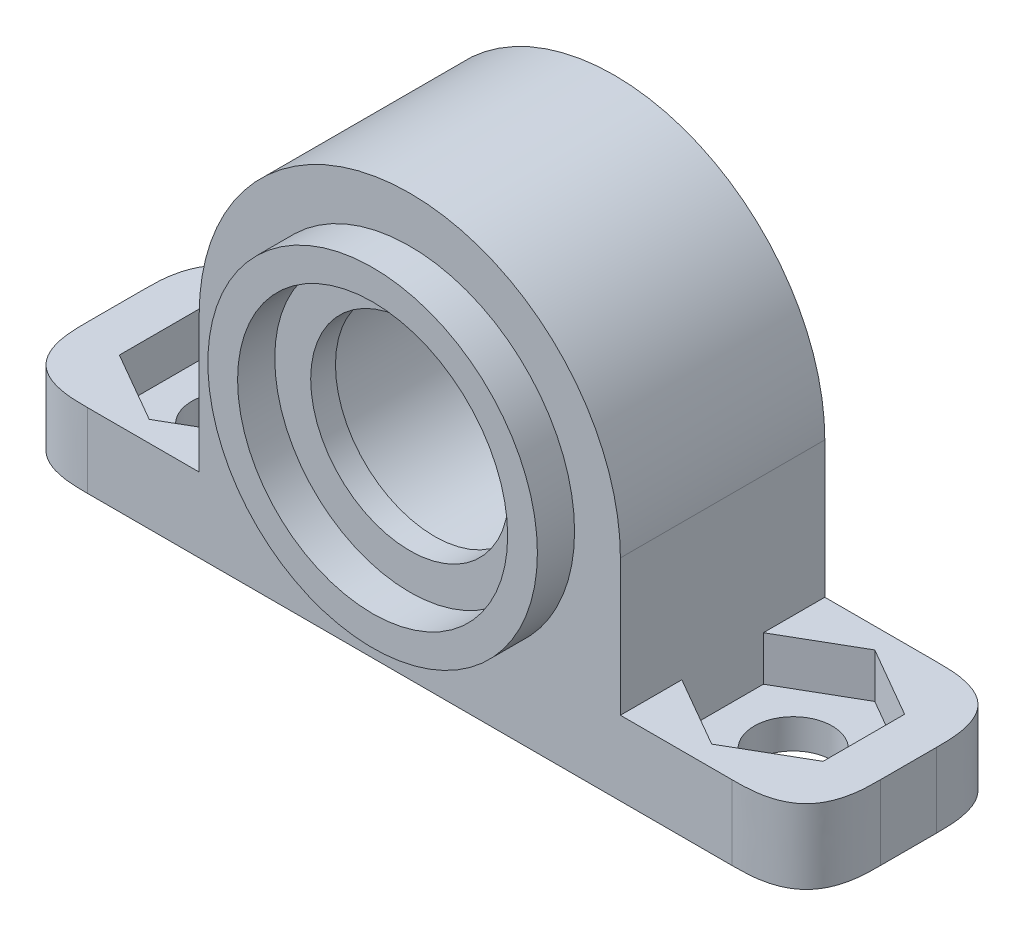
from build123d import *

# Parameters (mm, degrees)
SKETCH1_R           = 8.5
SKETCH1_R_2         = 4.6
BOSS_EXTRUDE1_DEPTH = 5.75
BOSS_EXTRUDE2_START = 1.5
SKETCH2_R           = 8.5
SKETCH2_R_2         = 7.1
BOSS_EXTRUDE2_DEPTH = 1.5
SKETCH3_R           = 8.5
SKETCH3_R_2         = 4
BOSS_EXTRUDE3_DEPTH = 1
SKETCH4_R           = 6.65
SKETCH4_R_2         = 5.45
BOSS_EXTRUDE4_DEPTH = 1.5
BOSS_EXTRUDE5_START = -8.25
SKETCH5_R           = 7.1
BOSS_EXTRUDE5_DEPTH = 8.25
FILLET1_SIZE        = 3
SKETCH6_R           = 1.575
CUT_EXTRUDE1_DEPTH  = 1.8
SKETCH6_3_R         = 1.575
CUT_EXTRUDE2_DEPTH  = 23.804878934
SHELL1_START        = 2
SHELL1_DEPTH        = 2.75
SHELL1_START_2      = 0.5
SHELL1_2_DEPTH      = 1.5


with BuildPart() as part:
    # Sketch1 → Boss-Extrude1 (new body)
    with BuildSketch(Plane.XY):
        Circle(SKETCH1_R)
        Circle(SKETCH1_R_2, mode=Mode.SUBTRACT)
    extrude(amount=BOSS_EXTRUDE1_DEPTH)

    # Sketch2 → Boss-Extrude2 (add)
    with BuildSketch(Plane(origin=(0, 0, 0), x_dir=(-1, 0, 0), z_dir=(0, 0, -1)).offset(BOSS_EXTRUDE2_START)):
        Circle(SKETCH2_R)
        Circle(SKETCH2_R_2, mode=Mode.SUBTRACT)
    extrude(amount=-BOSS_EXTRUDE2_DEPTH)

    # Sketch3 → Boss-Extrude3 (add)
    with BuildSketch(Plane.XY.offset(5.75)):
        with Locations(Location((0, 0, 0), (0, 0, 180))):
            Circle(SKETCH3_R)
        Circle(SKETCH3_R_2, mode=Mode.SUBTRACT)
    extrude(amount=BOSS_EXTRUDE3_DEPTH)

    # Sketch4 → Boss-Extrude4 (add)
    with BuildSketch(Plane.XY.offset(6.75)):
        Circle(SKETCH4_R)
        Circle(SKETCH4_R_2, mode=Mode.SUBTRACT)
    extrude(amount=BOSS_EXTRUDE4_DEPTH)

    # Sketch5 → Boss-Extrude5 (add)
    with BuildSketch(Plane.XY.offset(6.75).offset(BOSS_EXTRUDE5_START)):
        with BuildLine():
            Line((-8.5, 0), (-8.5, -5.5))
            Line((-8.5, -5.5), (-16, -5.5))
            Line((-16, -5.5), (-16, -8.5))
            Line((-16, -8.5), (16, -8.5))
            Line((16, -8.5), (16, -5.5))
            Line((16, -5.5), (8.5, -5.5))
            Line((8.5, -5.5), (8.5, 0))
            ThreePointArc((8.5, 0), (0, 8.5), (-8.5, 0))
        make_face()
        with Locations(Location((0, 0, 0), (0, 0, 180))):
            Circle(SKETCH5_R, mode=Mode.SUBTRACT)
    extrude(amount=BOSS_EXTRUDE5_DEPTH)

    # Fillet1
    # a fillet whose section is not a circle: 3 mm, written as the material it takes off along each edge
    with BuildSketch(Plane(origin=(-16, 2, -1.5), x_dir=(0, 0, 1), z_dir=(0, -1, 0)), Plane(origin=(-16, 2, 6.75), x_dir=(1, 0, 0), z_dir=(0, -1, 0)), Plane(origin=(16, -16, -1.5), x_dir=(0, 0, 1), z_dir=(0, 1, 0)), Plane(origin=(16, -16, 6.75), x_dir=(-1, 0, 0), z_dir=(0, 1, 0))) as fillet1_piece_1:
        with BuildLine():
            add(Edge.make_bspline([(FILLET1_SIZE, 0), (FILLET1_SIZE * 0.831801948466, 0), (FILLET1_SIZE * 0.663603896932, 0), (FILLET1_SIZE * 0.292893218813, -FILLET1_SIZE * 0.0716919198361), (FILLET1_SIZE * 0.0716919198361, -FILLET1_SIZE * 0.292893218813), (0, -FILLET1_SIZE * 0.663603896932), (0, -FILLET1_SIZE * 0.831801948466), (0, -FILLET1_SIZE)], knots=[0, 0, 0, 0, 0, 0, 0.5, 0.5, 1, 1, 1, 1, 1, 1], degree=5))
            Line((0, -FILLET1_SIZE), (0, 0))
            Line((0, 0), (FILLET1_SIZE, 0))
        make_face()
    extrude(amount=18, mode=Mode.SUBTRACT)

    # Sketch6 → Cut-Extrude1 (cut)
    # profile 1 of 2: a face of its own
    with BuildSketch(Plane(origin=(0, -5.5, 0), x_dir=(1, 0, 0), z_dir=(0, 1, 0))):
        Polygon((-11.35, 0.665896534), (-14.2, -0.979551733), (-14.2, -4.270448267), (-11.35, -5.915896534), (-8.5, -4.270448267), (-8.5, -0.979551733), align=None)
        with Locations((-11.35, -2.625)):
            Circle(SKETCH6_R, mode=Mode.SUBTRACT)
    # profile 2 of 2: a face of its own
    with BuildSketch(Plane(origin=(0, -5.5, 0), x_dir=(1, 0, 0), z_dir=(0, 1, 0))):
        with Locations((-11.35, -2.625)):
            Circle(SKETCH6_R)
    cut_extrude1 = extrude(amount=-CUT_EXTRUDE1_DEPTH, mode=Mode.SUBTRACT)

    # Sketch6<3> → Cut-Extrude2 (cut, through all)
    with BuildSketch(Plane(origin=(0, -5.5, 0), x_dir=(1, 0, 0), z_dir=(0, 1, 0))):
        with Locations(Location((-11.35, -2.625, 0), (0, 0, 270))):
            Circle(SKETCH6_3_R)
    cut_extrude2 = extrude(amount=-CUT_EXTRUDE2_DEPTH, mode=Mode.SUBTRACT)

    # Mirror1: Cut-Extrude1, Cut-Extrude2 across plane
    add(cut_extrude1.mirror(Plane(origin=(0, 0, 0), x_dir=(0, 0, 1), z_dir=(1, 0, 0))), mode=Mode.SUBTRACT)
    add(cut_extrude2.mirror(Plane(origin=(0, 0, 0), x_dir=(0, 0, 1), z_dir=(1, 0, 0))), mode=Mode.SUBTRACT)

    # Shell1: read off the stored shape, not the designer's step
    # Shell1 outline → Shell1 (cut)
    with BuildSketch(Plane.XY.offset(SHELL1_START)):
        with BuildLine():
            ThreePointArc((6.5, -1.144552314), (0, -6.6), (-6.5, -1.144552314))
            Line((-6.5, -1.144552314), (-6.5, -8.5))
            Line((-6.5, -8.5), (6.5, -8.5))
            Line((6.5, -8.5), (6.5, -1.144552314))
        make_face()
    extrude(amount=SHELL1_DEPTH, mode=Mode.SUBTRACT)

    # Shell1 2 outline → Shell1 2 (cut)
    with BuildSketch(Plane.XY.offset(SHELL1_START_2)):
        with BuildLine():
            Line((6.5, -8.5), (6.5, -6.368673331))
            ThreePointArc((6.5, -6.368673331), (4.989928684, -7.609902216), (3.249615362, -8.5))
            Line((3.249615362, -8.5), (6.5, -8.5))
        make_face()
        with BuildLine():
            ThreePointArc((-3.249615362, -8.5), (-4.989928684, -7.609902216), (-6.5, -6.368673331))
            Line((-6.5, -6.368673331), (-6.5, -8.5))
            Line((-6.5, -8.5), (-3.249615362, -8.5))
        make_face()
    extrude(amount=SHELL1_2_DEPTH, mode=Mode.SUBTRACT)


solid = part.part
